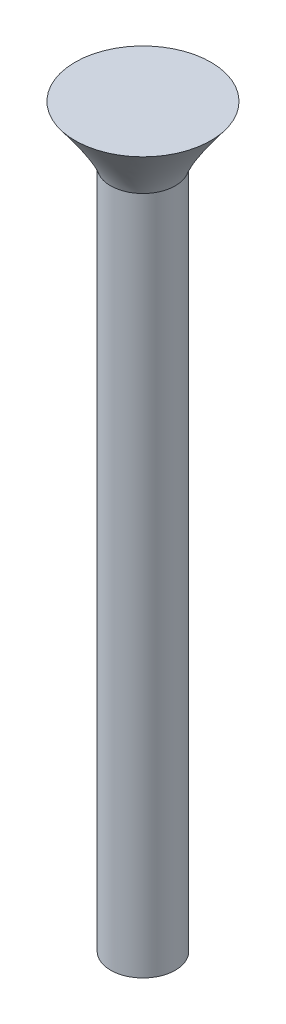
from build123d import *

# Parameters (mm, degrees)
SKETCH1_R           = 0.9525
BOSS_EXTRUDE1_DEPTH = 20


with BuildPart() as part:
    # Sketch1 → Boss-Extrude1 (new body)
    with BuildSketch(Plane(origin=(0, 0, 0), x_dir=(1, 0, 0), z_dir=(0, 1, 0))):
        with Locations(Location((0, 0, 0), (0, 0, 270))):
            Circle(SKETCH1_R)
    extrude(amount=BOSS_EXTRUDE1_DEPTH)

    # Loft1: read off the stored shape, not the designer's step
    # Loft1: loft between two sections, ruled curve by curve
    loft1_from = [
        Edge.make_bspline([(-0.868111621, 20, -0.391967427), (-1.652046474, 20, 1.344255815), (0.084176768, 20, 2.128190669), (0.868111621, 20, 0.391967427), (1.652046474, 20, -1.344255815), (-0.084176768, 20, -2.128190669), (-0.868111621, 20, -0.391967427)], [0, 0, 0, 0, 0.5, 0.5, 0.5, 1, 1, 1, 1], 3, [1, 0.333333333, 0.333333333, 1, 0.333333333, 0.333333333, 1]),
    ]
    loft1_to = [
        Edge.make_bspline([(-0.901256532, 21.6764, -1.785423385), (-4.472103302, 21.6764, 0.01708968), (-2.669590237, 21.6764, 3.587936449), (0.901256532, 21.6764, 1.785423385), (4.472103302, 21.6764, -0.01708968), (2.669590237, 21.6764, -3.587936449), (-0.901256532, 21.6764, -1.785423385)], [0, 0, 0, 0, 0.5, 0.5, 0.5, 1, 1, 1, 1], 3, [1, 0.333333333, 0.333333333, 1, 0.333333333, 0.333333333, 1]),
    ]
    loft1 = Solid(Shell([*[Face.make_surface_from_curves(loft1_from[k], loft1_to[k]) for k in range(1)], Face(Wire(loft1_from)), Face(Wire(loft1_to))]))
    add(loft1)


solid = part.part
